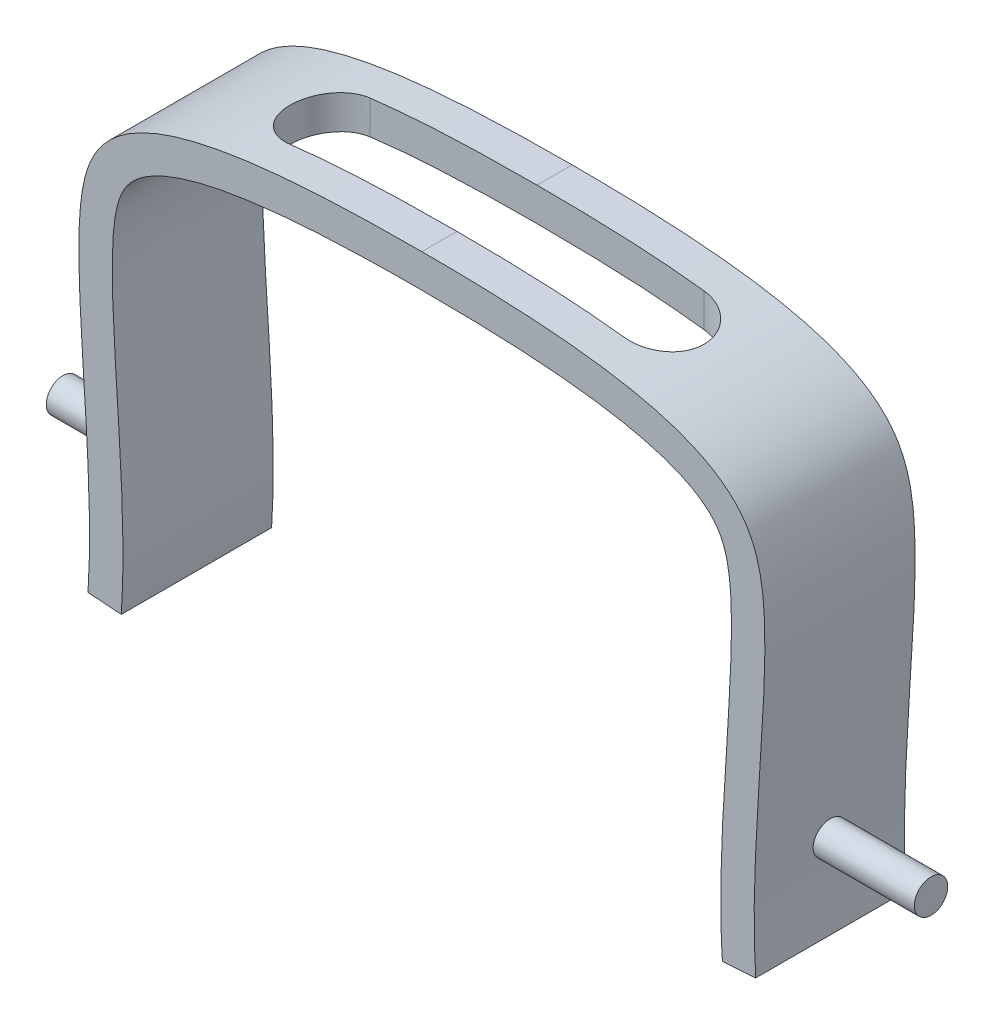
from build123d import *

# Parameters (mm, degrees)
MAIN_BODY_DEPTH              = 5.715
SLOT_FOR_JOYSTICK_DEPTH      = 127
SLOT_FOR_JOYSTICK_DEPTH_BACK = 127
SKETCH5_R                    = 1.27
NIBBLE_TWO_DEPTH             = 7.62
NIBBLE_TWO_DIRECTION_2_REACH = 64.831
SKETCH6_R                    = 1.27
NIBBLE_ONE_DEPTH             = 7.62
NIBBLE_ONE_DIRECTION_2_REACH = 70.617
SKETCH7_W                    = 3.81
SKETCH7_H                    = 1.27
FLAG_DEPTH                   = 0.254


with BuildPart() as part:
    # Sketch3 → main body (new, symmetric)
    with BuildSketch(Plane.XY):
        with BuildLine():
            Line((-25.392608442, 0.412757998), (-22.858784474, 0.235737941))
            add(Edge.make_bspline(
                [(-22.858784474, 0.235737941), (-22.207297233, 9.560974923), (-24.857071241, 24.747691028), (-20.428557404, 32.25929775), (-9.259543282, 33.02), (0, 33.02)],
                knots=[0, 0, 0, 0, 0.433889372, 0.533889372, 1, 1, 1, 1], degree=3))
            add(Edge.make_bspline(
                [(22.858784474, 0.235737941), (22.207297233, 9.560974923), (24.857071241, 24.747691028), (20.428557404, 32.25929775), (9.259543282, 33.02), (0, 33.02)],
                knots=[0, 0, 0, 0, 0.433889372, 0.533889372, 1, 1, 1, 1], degree=3))
            Line((22.858784474, 0.235737941), (25.392608442, 0.412757998))
            add(Edge.make_bspline(
                [(0, 35.56), (1.254311658, 35.56), (3.775402004, 35.537283686), (8.716263904, 35.364909913), (13.364408191, 34.95031307), (17.451619904, 34.157368544), (20.19143925, 33.318161822), (22.191145094, 32.324605138), (23.581645529, 31.247774677), (24.510467356, 30.223143514), (25.221212474, 28.976764345), (25.816104763, 27.16552201), (26.097899373, 24.685629746), (26.104154518, 21.203211789), (25.906005631, 17.271643308), (25.62301776, 13.038150403), (25.363639259, 8.672591167), (25.255928833, 5.092554321), (25.287282478, 2.342948324), (25.34716307, 1.063252489), (25.392608442, 0.412757998)],
                knots=[0, 0, 0, 0, 0.0625, 0.125, 0.25, 0.3125, 0.375, 0.4375, 0.46875, 0.5, 0.53125, 0.5625, 0.625, 0.6875, 0.75, 0.8125, 0.875, 0.9375, 0.96875, 1, 1, 1, 1], degree=3))
            add(Edge.make_bspline(
                [(-25.392608442, 0.412757998), (-25.34716307, 1.063252489), (-25.287282478, 2.342948324), (-25.255928833, 5.092554321), (-25.363639259, 8.672591167), (-25.62301776, 13.038150403), (-25.906005631, 17.271643308), (-26.104154518, 21.203211789), (-26.097899373, 24.685629746), (-25.816104763, 27.16552201), (-25.221212474, 28.976764345), (-24.510467356, 30.223143514), (-23.581645529, 31.247774677), (-22.191145094, 32.324605138), (-20.19143925, 33.318161822), (-17.451619904, 34.157368544), (-13.364408191, 34.95031307), (-8.716263904, 35.364909913), (-3.775402004, 35.537283686), (-1.254311658, 35.56), (0, 35.56)],
                knots=[0, 0, 0, 0, 0.03125, 0.0625, 0.125, 0.1875, 0.25, 0.3125, 0.375, 0.4375, 0.46875, 0.5, 0.53125, 0.5625, 0.625, 0.6875, 0.75, 0.875, 0.9375, 1, 1, 1, 1], degree=3))
        make_face()
    extrude(amount=MAIN_BODY_DEPTH, both=True)

    # Sketch4 → slot for joystick (cut, two sides: drawn at the far end of the back side and taken through both)
    with BuildSketch(Plane(origin=(0, 35.56, 0), x_dir=(1, 0, 0), z_dir=(0, 1, 0)).offset(-SLOT_FOR_JOYSTICK_DEPTH_BACK)):
        with BuildLine():
            Line((-12.7, 3.048), (12.7, 3.048))
            ThreePointArc((12.7, 3.048), (15.748, 0), (12.7, -3.048))
            Line((12.7, -3.048), (-12.7, -3.048))
            ThreePointArc((-12.7, -3.048), (-15.748, 0), (-12.7, 3.048))
        make_face()
    extrude(amount=SLOT_FOR_JOYSTICK_DEPTH + SLOT_FOR_JOYSTICK_DEPTH_BACK, mode=Mode.SUBTRACT)

    # Sketch5 → nibble two (add)
    with BuildSketch(Plane(origin=(25.392608442, 0, 0), x_dir=(0, 0, -1), z_dir=(1, 0, 0))):
        with Locations((0, 6.762757998)):
            Circle(SKETCH5_R)
    extrude(amount=NIBBLE_TWO_DEPTH)

    # Sketch5 → nibble two direction 2 (add, up to next)
    with BuildSketch(Plane(origin=(25.392608442, 0, 0), x_dir=(0, 0, -1), z_dir=(1, 0, 0)), mode=Mode.PRIVATE) as nibble_two_direction_2_sk1:
        with Locations((0, 6.762757998)):
            Circle(SKETCH5_R)
    nibble_two_direction_2_tool1 = extrude(nibble_two_direction_2_sk1.sketch, amount=-NIBBLE_TWO_DIRECTION_2_REACH, mode=Mode.PRIVATE) - part.part
    add(nibble_two_direction_2_tool1.solids().sort_by_distance((25.392608, 6.762758, 0))[0])

    # Sketch6 → nibble one (add)
    with BuildSketch(Plane(origin=(-25.392608442, 0, 0), x_dir=(0, 0, -1), z_dir=(1, 0, 0))):
        with Locations((0, 6.762757998)):
            Circle(SKETCH6_R)
    extrude(amount=-NIBBLE_ONE_DEPTH)

    # Sketch6 → nibble one direction 2 (add, up to next)
    with BuildSketch(Plane(origin=(-25.392608442, 0, 0), x_dir=(0, 0, -1), z_dir=(1, 0, 0)), mode=Mode.PRIVATE) as nibble_one_direction_2_sk1:
        with Locations((0, 6.762757998)):
            Circle(SKETCH6_R)
    nibble_one_direction_2_tool1 = extrude(nibble_one_direction_2_sk1.sketch, amount=NIBBLE_ONE_DIRECTION_2_REACH, mode=Mode.PRIVATE) - part.part
    add(nibble_one_direction_2_tool1.solids().sort_by_distance((-25.392608, 6.762758, 0))[0])

    # Sketch7 → flag (add)
    with BuildSketch(Plane(origin=(0, 6.762757998, 0), x_dir=(1, 0, 0), z_dir=(0, 1, 0))):
        with Locations((-29.429266279, -0.015489835)):
            Rectangle(SKETCH7_W, SKETCH7_H)
    extrude(amount=-FLAG_DEPTH)


solid = part.part
